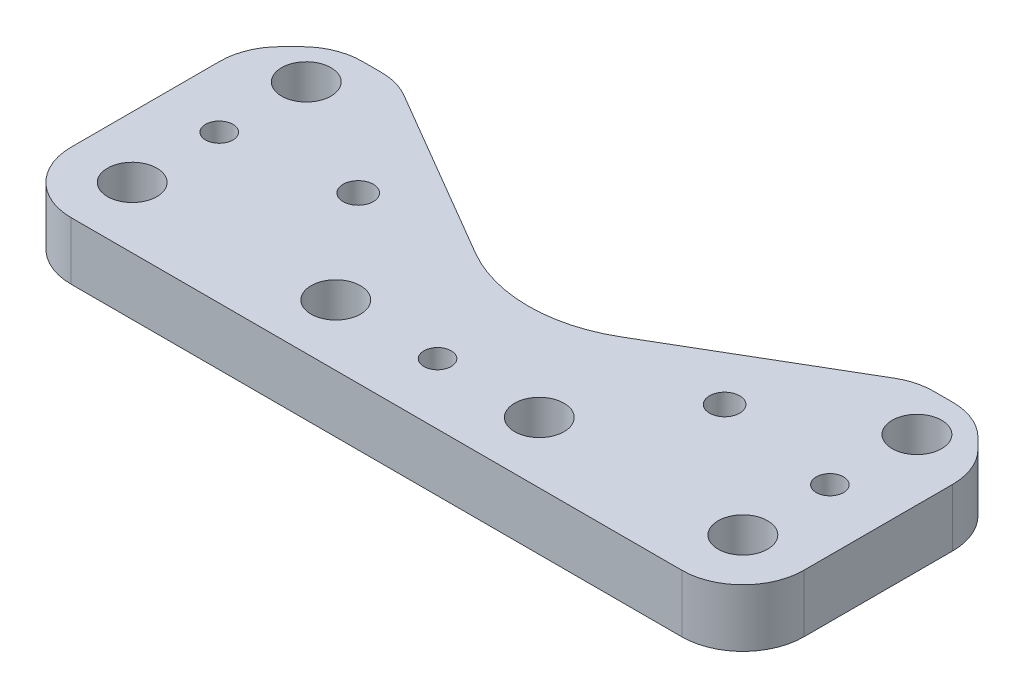
from build123d import *

# Parameters (mm, degrees)
SKETCH1_R           = 15
BOSS_EXTRUDE1_DEPTH = 6
SKETCH2_R           = 1.5
CUT_EXTRUDE1_DEPTH  = 92.777339251
CUT_EXTRUDE2_DEPTH  = 92.777339251
SKETCH13_R          = 1.65
M4_TAP_DEPTH        = 85.985660555
SKETCH15_R          = 2.65
M5_THROUGH_DEPTH    = 83.615146916
FILLET1_R           = 6.35
CUT_EXTRUDE4_START  = -10
CUT_EXTRUDE4_DEPTH  = 10
FILLET2_R           = 6.35
SKETCH17_R          = 1.5
CUT_EXTRUDE5_DEPTH  = 82.827930172
MOVE_FACE1_BY       = 0.08
MOVE_FACE1_2_BY     = 0.08
MOVE_FACE1_3_BY     = 0.08
MOVE_FACE1_4_BY     = 0.08
MOVE_FACE1_5_BY     = 0.08
MOVE_FACE1_6_BY     = 0.08
MOVE_FACE1_7_BY     = 0.08
MOVE_FACE1_8_BY     = 0.08
MOVE_FACE1_9_BY     = 0.08
MOVE_FACE1_10_BY    = 0.08
MOVE_FACE1_11_BY    = 0.08


with BuildPart() as part:
    # Sketch1 → Boss-Extrude1 (new body)
    with BuildSketch(Plane(origin=(0, 0, 0), x_dir=(1, 0, 0), z_dir=(0, 1, 0))):
        Polygon((0, 0), (76.2, 0), (76.2, 50.8), (38.1, 50.8), (0, 50.8), align=None)
        with Locations(Location((38.1, 30.8, 0), (0, 0, 270))):
            Circle(SKETCH1_R, mode=Mode.SUBTRACT)
    extrude(amount=BOSS_EXTRUDE1_DEPTH)

    # Sketch2 → Cut-Extrude1 (cut, through all)
    with BuildSketch(Plane(origin=(0, 6, 0), x_dir=(1, 0, 0), z_dir=(0, 1, 0))):
        with Locations(Location((19.05, 30.8, 0), (0, 0, 270))):
            Circle(SKETCH2_R)
        with Locations(Location((57.15, 30.8, 0), (0, 0, 90))):
            Circle(SKETCH2_R)
    extrude(amount=-CUT_EXTRUDE1_DEPTH, mode=Mode.SUBTRACT)

    # Sketch9 → Cut-Extrude2 (cut, through all)
    with BuildSketch(Plane(origin=(0, 6, 0), x_dir=(1, 0, 0), z_dir=(0, 1, 0))):
        with BuildLine():
            Line((0, 50.8), (76.2, 50.8))
            Line((76.2, 50.8), (76.2, 24.45))
            Line((76.2, 24.45), (63.5, 37.15))
            Line((63.5, 37.15), (53.1, 37.15))
            Line((53.1, 37.15), (53.1, 30.8))
            ThreePointArc((53.1, 30.8), (38.1, 15.8), (23.1, 30.8))
            Line((23.1, 30.8), (23.1, 37.15))
            Line((23.1, 37.15), (12.7, 37.15))
            Line((12.7, 37.15), (0, 24.45))
            Line((0, 24.45), (0, 50.8))
        make_face()
    extrude(amount=-CUT_EXTRUDE2_DEPTH, mode=Mode.SUBTRACT)

    # Sketch13 → M4-tap (cut, through all)
    with BuildSketch(Plane(origin=(0, 6, 0), x_dir=(1, 0, 0), z_dir=(0, 1, 0))):
        with Locations(Location((19.05, 17.15, 0), (0, 0, 270))):
            Circle(SKETCH13_R)
        with Locations(Location((57.15, 17.15, 0), (0, 0, 270))):
            Circle(SKETCH13_R)
    extrude(amount=-M4_TAP_DEPTH, mode=Mode.SUBTRACT)

    # Sketch15 → M5-through (cut, through all)
    with BuildSketch(Plane(origin=(0, 6, -5.8), x_dir=(1, 0, 0), z_dir=(0, -1, 0))):
        with Locations(Location((6.35, -18.65, 0), (0, 0, 270))):
            Circle(SKETCH15_R)
        with Locations(Location((6.35, -0.55, 0), (0, 0, 270))):
            Circle(SKETCH15_R)
        with Locations(Location((27.516666667, -0.55, 0), (0, 0, 270))):
            Circle(SKETCH15_R)
        with Locations(Location((48.683333333, -0.55, 0), (0, 0, 270))):
            Circle(SKETCH15_R)
        with Locations(Location((69.85, -0.55, 0), (0, 0, 270))):
            Circle(SKETCH15_R)
        with Locations(Location((69.85, -18.65, 0), (0, 0, 270))):
            Circle(SKETCH15_R)
    extrude(amount=M5_THROUGH_DEPTH, mode=Mode.SUBTRACT)

    # Fillet1
    fillet1_edges = [part.edges().sort_by_distance(p)[0] for p in [
        (76.2, 3, 0),
        (0, 3, 0),
        (0, 3, -24.45),
        (76.2, 3, -24.45),
        (63.5, 3, -37.15),
        (53.1, 3, -37.15),
        (23.1, 3, -37.15),
        (12.7, 3, -37.15),
    ]]
    fillet(fillet1_edges, radius=FILLET1_R - 0.0001)  # a hair under: the kernel refuses the full size

    # Sketch16 → Cut-Extrude4 (cut)
    with BuildSketch(Plane(origin=(0, 6, 0), x_dir=(1, 0, 0), z_dir=(0, 1, 0)).offset(CUT_EXTRUDE4_START)):
        with BuildLine():
            Line((30.524360743, 17.853583899), (11.1125, 29.2125))
            Line((11.1125, 29.2125), (4.7625, 29.2125))
            Line((4.7625, 29.2125), (38.1, 62.55))
            Line((38.1, 62.55), (71.4375, 29.2125))
            Line((71.4375, 29.2125), (65.0875, 29.2125))
            Line((65.0875, 29.2125), (45.675639257, 17.853583899))
            ThreePointArc((45.675639257, 17.853583899), (38.1, 15.8), (30.524360743, 17.853583899))
        make_face()
    extrude(amount=CUT_EXTRUDE4_DEPTH, mode=Mode.SUBTRACT)

    # Fillet2
    fillet2_edges = [part.edges().sort_by_distance(p)[0] for p in [
        (11.1125, 3, -29.2125),
        (4.7625, 3, -29.2125),
        (71.4375, 3, -29.2125),
        (65.0875, 3, -29.2125),
    ]]
    fillet(fillet2_edges, radius=FILLET2_R)

    # Sketch17 → Cut-Extrude5 (cut, through all)
    with BuildSketch(Plane(origin=(0, 6, 0), x_dir=(-1, 0, 0), z_dir=(0, 1, 0))):
        with Locations(Location((-6.35, -15.4, 0), (0, 0, 90))):
            Circle(SKETCH17_R)
        with Locations(Location((-38.1, -6.35, 0), (0, 0, 90))):
            Circle(SKETCH17_R)
        with Locations(Location((-69.85, -15.4, 0), (0, 0, 90))):
            Circle(SKETCH17_R)
    extrude(amount=-CUT_EXTRUDE5_DEPTH, mode=Mode.SUBTRACT)

    # Move Face1: a curved face moved outward by 0.08
    add(Solid.thicken(part.faces().sort_by_distance((6.35, 3, -21.8))[0], MOVE_FACE1_BY))

    # Move Face1 2: a curved face moved outward by 0.08
    add(Solid.thicken(part.faces().sort_by_distance((19.05, 3, -18.8))[0], MOVE_FACE1_2_BY))

    # Move Face1 3: a curved face moved outward by 0.08
    add(Solid.thicken(part.faces().sort_by_distance((57.15, 3, -18.8))[0], MOVE_FACE1_3_BY))

    # Move Face1 4: a curved face moved outward by 0.08
    add(Solid.thicken(part.faces().sort_by_distance((6.35, 3, -3.7))[0], MOVE_FACE1_4_BY))

    # Move Face1 5: a curved face moved outward by 0.08
    add(Solid.thicken(part.faces().sort_by_distance((27.516666667, 3, -3.7))[0], MOVE_FACE1_5_BY))

    # Move Face1 6: a curved face moved outward by 0.08
    add(Solid.thicken(part.faces().sort_by_distance((48.683333333, 3, -3.7))[0], MOVE_FACE1_6_BY))

    # Move Face1 7: a curved face moved outward by 0.08
    add(Solid.thicken(part.faces().sort_by_distance((69.85, 3, -3.7))[0], MOVE_FACE1_7_BY))

    # Move Face1 8: a curved face moved outward by 0.08
    add(Solid.thicken(part.faces().sort_by_distance((69.85, 3, -21.8))[0], MOVE_FACE1_8_BY))

    # Move Face1 9: a curved face moved outward by 0.08
    add(Solid.thicken(part.faces().sort_by_distance((6.35, 3, -16.9))[0], MOVE_FACE1_9_BY))

    # Move Face1 10: a curved face moved outward by 0.08
    add(Solid.thicken(part.faces().sort_by_distance((38.1, 3, -7.85))[0], MOVE_FACE1_10_BY))

    # Move Face1 11: a curved face moved outward by 0.08
    add(Solid.thicken(part.faces().sort_by_distance((69.85, 3, -16.9))[0], MOVE_FACE1_11_BY))


solid = part.part
